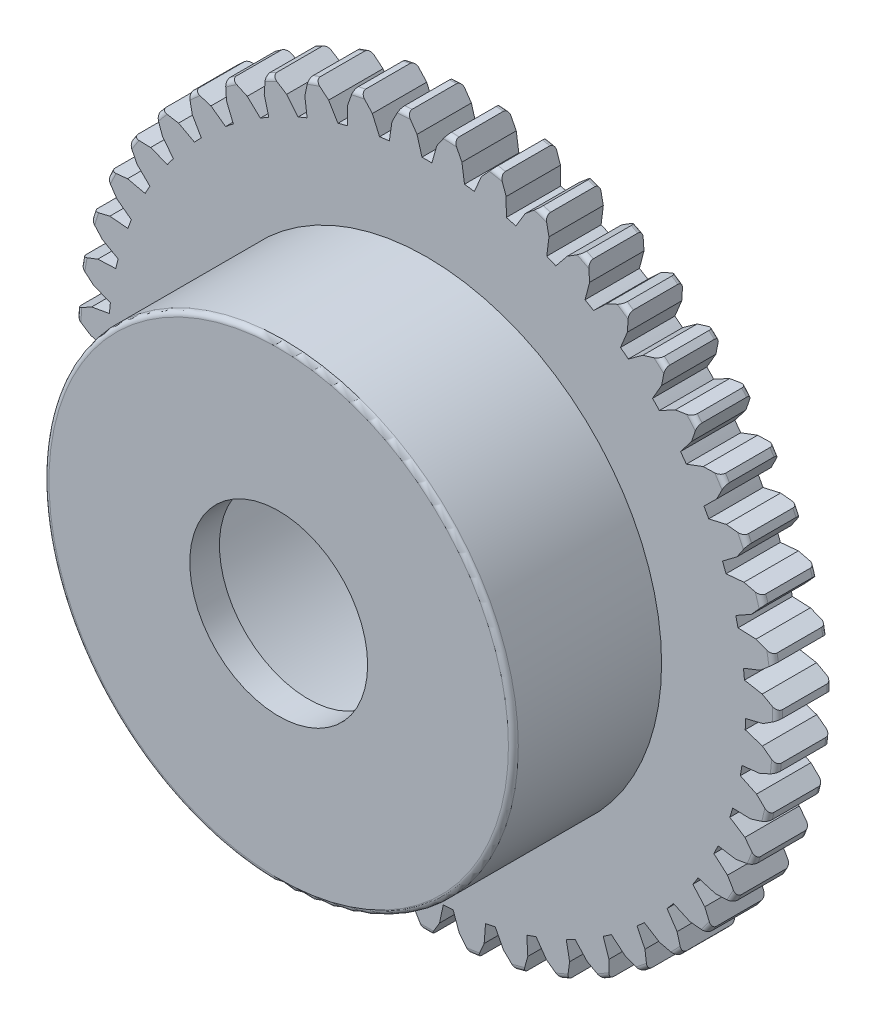
from build123d import *

# Parameters (mm, degrees)
CROQUIS1_R              = 7.1
CROQUIS1_R_2            = 4
SALIENTE_EXTRUIR1_DEPTH = 1.1
CORTAR_EXTRUIR1_DEPTH   = 1.1
REDONDEO2_R             = 0.1
MATRIZC1_COUNT          = 47
CROQUIS4_R              = 4.75
SALIENTE_EXTRUIR2_DEPTH = 3
REDONDEO3_R             = 0.1
CROQUIS2_6_R            = 1.8
CORTAR_EXTRUIR3_DEPTH   = 4.5
CROQUIS1_4_R            = 4
CORTAR_EXTRUIR4_DEPTH   = 3.5


with BuildPart() as part:
    # Croquis1 → Saliente-Extruir1 (new body)
    with BuildSketch(Plane.XY):
        Circle(CROQUIS1_R)
        Circle(CROQUIS1_R_2, mode=Mode.SUBTRACT)
    extrude(amount=SALIENTE_EXTRUIR1_DEPTH)

    # Croquis2 → Cortar-Extruir1 (cut)
    with BuildSketch(Plane.XY.offset(1.1)):
        with BuildLine():
            ThreePointArc((-0.1, 6.44922476), (0, 6.45), (0.1, 6.44922476))
            Line((0.1, 6.44922476), (0.2, 6.8))
            Line((0.2, 6.8), (0.4, 7.088723439))
            Line((0.4, 7.088723439), (0.4, 7.202922643))
            Line((0.4, 7.202922643), (-0.4, 7.202922643))
            Line((-0.4, 7.202922643), (-0.4, 7.088723439))
            Line((-0.4, 7.088723439), (-0.2, 6.8))
            Line((-0.2, 6.8), (-0.1, 6.44922476))
        make_face()
    cortar_extruir1 = extrude(amount=-CORTAR_EXTRUIR1_DEPTH, mode=Mode.SUBTRACT)

    # Redondeo2
    redondeo2_edges = [part.edges().sort_by_distance(p)[0] for p in [
        (0, -7.1, 0),
        (0, -7.1, 1.1),
    ]]
    fillet(redondeo2_edges, radius=REDONDEO2_R)

    # MatrizC1: Cortar-Extruir1 ×47 about axis
    matrizc1_axis = Axis((0, 0, 1.1), (0, 0, -1))
    for i in range(1, MATRIZC1_COUNT):
        add(cortar_extruir1.rotate(matrizc1_axis, i * 360 / MATRIZC1_COUNT), mode=Mode.SUBTRACT)

    # Croquis4 → Saliente-Extruir2 (add)
    with BuildSketch(Plane.XY.offset(1.1)):
        Circle(CROQUIS4_R)
    extrude(amount=SALIENTE_EXTRUIR2_DEPTH)

    # Redondeo3
    redondeo3_edges = [part.edges().sort_by_distance(p)[0] for p in [
        (-4.75, 0, 4.1),
    ]]
    fillet(redondeo3_edges, radius=REDONDEO3_R)

    # Croquis2<6> → Cortar-Extruir3 (cut)
    with BuildSketch(Plane.XY.offset(1.1)):
        Circle(CROQUIS2_6_R)
    extrude(amount=CORTAR_EXTRUIR3_DEPTH, mode=Mode.SUBTRACT)

    # Croquis1<4> → Cortar-Extruir4 (cut)
    with BuildSketch(Plane.XY):
        Circle(CROQUIS1_4_R)
    extrude(amount=CORTAR_EXTRUIR4_DEPTH, mode=Mode.SUBTRACT)


solid = part.part
